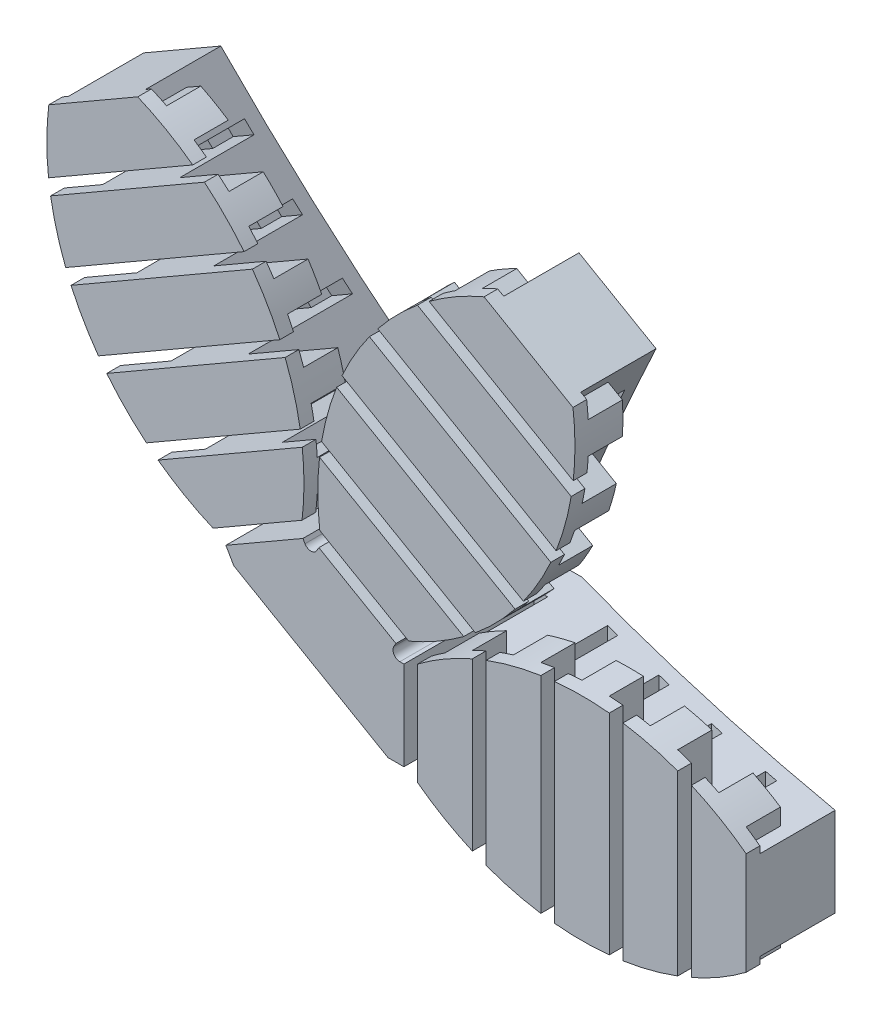
from build123d import *

# Parameters (mm, degrees)
AUFSATZ_LINEAR_AUSTRAGEN7_DEPTH  = 1
AUFSATZ_LINEAR_AUSTRAGEN1_DEPTH  = 6.5
AUFSATZ_LINEAR_AUSTRAGEN2_DEPTH  = 2
SCHNITT_LINEAR_AUSTRAGEN1_DEPTH  = 15.3
AUFSATZ_LINEAR_AUSTRAGEN3_DEPTH  = 3
KREISMUSTER4_COUNT               = 3
KREISMUSTER4_ANGLE               = 120
WANDUNG1_START                   = -18
WANDUNG1_DEPTH                   = 9
WANDUNG1_START_2                 = -14.5
WANDUNG1_2_DEPTH                 = 2
WANDUNG1_3_DEPTH                 = 9
WANDUNG1_4_DEPTH                 = 2
WANDUNG1_START_3                 = -4.5
WANDUNG1_5_DEPTH                 = 9
WANDUNG1_START_4                 = -1
WANDUNG1_6_DEPTH                 = 2
AUFSATZ_LINEAR_AUSTRAGEN4_DEPTH  = 5
SOCKEL_DEPTH                     = 23
AUFSATZ_LINEAR_AUSTRAGEN6_DEPTH  = 6.5
KREISMUSTER6_COUNT               = 3
KREISMUSTER6_ANGLE               = 120
VERRUNDUNG1_R                    = 1
SKIZZE10_W                       = 2
SKIZZE10_H                       = 2
SCHNITT_LINEAR_AUSTRAGEN3_DEPTH  = 2
SCHNITT_LINEAR_AUSTRAGEN7_DEPTH  = 21
SCHNITT_LINEAR_AUSTRAGEN4_DEPTH  = 2
SKIZZE15_W                       = 4
SKIZZE15_H                       = 2
SCHNITT_LINEAR_AUSTRAGEN6_DEPTH  = 2
AUFSATZ_LINEAR_START             = -1
AUFSATZ_LINEAR_AUSTRAGEN8_DEPTH  = 1
AUFSATZ_LINEAR_START_2           = 3
SKIZZE20_W                       = 2
SKIZZE20_H                       = 1
AUFSATZ_LINEAR_AUSTRAGEN9_DEPTH  = 4
AUFSATZ_LINEAR_START_3           = 11
AUFSATZ_LINEAR_AUSTRAGEN10_DEPTH = 11
KREISMUSTER7_COUNT               = 3
KREISMUSTER7_ANGLE               = 120
KREISMUSTER7_START               = -1
KREISMUSTER7_COPY_1_DEPTH        = 1
KREISMUSTER7_COPY_2_DEPTH        = 1
KREISMUSTER7_START_2             = 3
KREISMUSTER7_COPY_3_SKETCH_W     = 2
KREISMUSTER7_COPY_3_SKETCH_H     = 1
KREISMUSTER7_COPY_3_DEPTH        = 4
KREISMUSTER7_COPY_4_SKETCH_W     = 2
KREISMUSTER7_COPY_4_SKETCH_H     = 1
KREISMUSTER7_COPY_4_DEPTH        = 4
AUFSATZ_LINEAR_START_4           = 1
AUFSATZ_LINEAR_AUSTRAGEN11_DEPTH = 1


# Read off the part's stored shape, not the designer's step: Wandung1
with BuildPart() as part:
    # Skizze8 → Aufsatz-Linear austragen7 (new body)
    with BuildSketch(Plane.XY):
        with BuildLine():
            Line((-4.763139721, -6.25), (-26.413774815, 6.25))
            ThreePointArc((-26.413774815, 6.25), (-24.774043804, 8.477912479), (-22.684450569, 10.290620927))
            Line((-22.684450569, 10.290620927), (-24.248711306, 13))
            Line((-24.248711306, 13), (-22.516660498, 14))
            Line((-22.516660498, 14), (-20.952399762, 11.290620927))
            ThreePointArc((-20.952399762, 11.290620927), (-15.588457268, 12.5), (-10.224514775, 11.290620927))
            Line((-10.224514775, 11.290620927), (-8.660254038, 14))
            Line((-8.660254038, 14), (-6.92820323, 13))
            Line((-6.92820323, 13), (-8.492463967, 10.290620927))
            ThreePointArc((-8.492463967, 10.290620927), (-4.763139721, 6.25), (-3.128521474, 1))
            Line((-3.128521474, 1), (0, 1))
            Line((0, 1), (0, -1))
            Line((0, -1), (-3.128521474, -1))
            ThreePointArc((-3.128521474, -1), (-3.653576423, -3.715995049), (-4.763139721, -6.25))
        make_face()
    extrude(amount=-AUFSATZ_LINEAR_AUSTRAGEN7_DEPTH)

    # Skizze2 → Aufsatz-Linear austragen1 (add, symmetric)
    with BuildSketch(Plane(origin=(0, 0, 0), x_dir=(1, 0, 0), z_dir=(0, 1, 0))):
        with BuildLine():
            Line((0, 23), (0, 0))
            Line((0, 0), (48, 0))
            Line((48, 0), (48, 12))
            ThreePointArc((48, 12), (23.86042445, 16.890943056), (0, 23))
        make_face()
    aufsatz_linear_austragen1 = extrude(amount=AUFSATZ_LINEAR_AUSTRAGEN1_DEPTH, both=True)

    # Skizze1 → Aufsatz-Linear austragen2 (add)
    with BuildSketch(Plane.XY):
        with BuildLine():
            Line((0, -7.5), (0, 7.5))
            ThreePointArc((0, 7.5), (24, 15.5), (48, 7.5))
            Line((48, 7.5), (48, -7.5))
            ThreePointArc((48, -7.5), (24, -15.5), (0, -7.5))
        make_face()
    aufsatz_linear_austragen2 = extrude(amount=-AUFSATZ_LINEAR_AUSTRAGEN2_DEPTH)

    # Skizze3 → Schnitt-Linear austragen1 (cut, symmetric)
    with BuildSketch(Plane(origin=(0, 0, 0), x_dir=(1, 0, 0), z_dir=(0, 1, 0))):
        Polygon((8, 0), (8, 19.77324167), (10, 19.249193658), (10, 0), align=None)
        Polygon((18, 0), (18, 17.243401122), (20, 16.764409199), (20, 0), align=None)
        Polygon((28, 0), (28, 14.937451344), (30, 14.502836106), (30, 0), align=None)
        Polygon((38, 0), (38, 12.852146674), (40, 12.461303435), (40, 0), align=None)
    schnitt_linear_austragen1 = extrude(amount=SCHNITT_LINEAR_AUSTRAGEN1_DEPTH, both=True, mode=Mode.SUBTRACT)

    # Skizze4 → Aufsatz-Linear austragen3 (add, symmetric)
    with BuildSketch(Plane(origin=(0, 0, 0), x_dir=(1, 0, 0), z_dir=(0, 1, 0))):
        Polygon((8, 16.77324167), (8, 19.77324167), (10, 19.249193658), (10, 16.249193658), align=None)
        Polygon((18, 14.243401122), (18, 17.243401122), (20, 16.764409199), (20, 13.764409199), align=None)
        Polygon((28, 11.937451344), (28, 14.937451344), (30, 14.502836106), (30, 11.502836106), align=None)
        Polygon((38, 9.852146674), (38, 12.852146674), (40, 12.461303435), (40, 9.461303435), align=None)
    aufsatz_linear_austragen3 = extrude(amount=AUFSATZ_LINEAR_AUSTRAGEN3_DEPTH, both=True)

    # Kreismuster4: Aufsatz-Linear austragen1, Aufsatz-Linear austragen2, Schnitt-Linear austragen1, Aufsatz-Linear austragen3 ×3 about axis
    kreismuster4_axis = Axis((-15.588457268, 0, 0), (0, 0, 1))
    add([aufsatz_linear_austragen1.rotate(kreismuster4_axis, i * KREISMUSTER4_ANGLE / (KREISMUSTER4_COUNT - 1)) for i in range(1, KREISMUSTER4_COUNT)])
    add([aufsatz_linear_austragen2.rotate(kreismuster4_axis, i * KREISMUSTER4_ANGLE / (KREISMUSTER4_COUNT - 1)) for i in range(1, KREISMUSTER4_COUNT)])
    add([schnitt_linear_austragen1.rotate(kreismuster4_axis, i * KREISMUSTER4_ANGLE / (KREISMUSTER4_COUNT - 1)) for i in range(1, KREISMUSTER4_COUNT)], mode=Mode.SUBTRACT)
    add([aufsatz_linear_austragen3.rotate(kreismuster4_axis, i * KREISMUSTER4_ANGLE / (KREISMUSTER4_COUNT - 1)) for i in range(1, KREISMUSTER4_COUNT)])

    # Wandung1 outline → Wandung1 (cut)
    with BuildSketch(Plane(origin=(0, 0, 0), x_dir=(0.500000000000004, -0.8660254037844363, 0), z_dir=(0.8660254037844363, 0.5000000000000042, 0)).offset(WANDUNG1_START)):
        with BuildLine():
            Line((-69.382685902, 12.356970834), (-69.382685902, 2))
            Line((-69.382685902, 2), (-64.382685902, 2))
            Line((-64.382685902, 2), (-64.382685902, 13.287271037))
            ThreePointArc((-64.382685902, 13.287271037), (-66.881467565, 12.815572851), (-69.382685902, 12.356970834))
        make_face()
        with BuildLine():
            Line((-60.382685902, 14.070634881), (-60.382685902, 2))
            Line((-60.382685902, 2), (-54.382685902, 2))
            Line((-54.382685902, 2), (-54.382685902, 15.311291382))
            ThreePointArc((-54.382685902, 15.311291382), (-57.380728501, 14.68149685), (-60.382685902, 14.070634881))
        make_face()
        with BuildLine():
            ThreePointArc((-44.382685902, 17.555569802), (-47.380509467, 16.859476754), (-50.382685902, 16.182403412))
            Line((-50.382685902, 16.182403412), (-50.382685902, 2))
            Line((-50.382685902, 2), (-44.382685902, 2))
            Line((-44.382685902, 2), (-44.382685902, 17.555569802))
        make_face()
        with BuildLine():
            ThreePointArc((-34.382685902, 20.023261295), (-37.380284188, 19.259896067), (-40.382685902, 18.515647523))
            Line((-40.382685902, 18.515647523), (-40.382685902, 2))
            Line((-40.382685902, 2), (-34.382685902, 2))
            Line((-34.382685902, 2), (-34.382685902, 20.023261295))
        make_face()
        with BuildLine():
            ThreePointArc((-24.382685902, 22.717904905), (-27.380051853, 21.886176888), (-30.382685902, 21.073672793))
            Line((-30.382685902, 21.073672793), (-30.382685902, 2))
            Line((-30.382685902, 2), (-24.382685902, 2))
            Line((-24.382685902, 2), (-24.382685902, 22.717904905))
        make_face()
    extrude(amount=WANDUNG1_DEPTH, mode=Mode.SUBTRACT)

    # Wandung1 2 outline → Wandung1 2 (cut)
    with BuildSketch(Plane(origin=(0, 0, 0), x_dir=(0.500000000000004, -0.8660254037844363, 0), z_dir=(0.8660254037844363, 0.5000000000000042, 0)).offset(WANDUNG1_START_2)):
        with BuildLine():
            Line((-64.382685902, 13.287271037), (-64.382685902, 11.303713614))
            Line((-64.382685902, 11.303713614), (-60.382685902, 12.085400091))
            Line((-60.382685902, 12.085400091), (-60.382685902, 14.070634881))
            ThreePointArc((-60.382685902, 14.070634881), (-62.381863699, 13.674754637), (-64.382685902, 13.287271037))
        make_face()
        with BuildLine():
            ThreePointArc((-50.382685902, 16.182403412), (-52.381767614, 15.742630771), (-54.382685902, 15.311291382))
            Line((-54.382685902, 15.311291382), (-54.382685902, 13.332206382))
            Line((-54.382685902, 13.332206382), (-50.382685902, 14.201436857))
            Line((-50.382685902, 14.201436857), (-50.382685902, 16.182403412))
        make_face()
        with BuildLine():
            ThreePointArc((-40.382685902, 18.515647523), (-42.381668923, 18.031371591), (-44.382685902, 17.555569802))
            Line((-44.382685902, 17.555569802), (-44.382685902, 15.581471835))
            Line((-44.382685902, 15.581471835), (-40.382685902, 16.53945568))
            Line((-40.382685902, 16.53945568), (-40.382685902, 18.515647523))
        make_face()
        with BuildLine():
            ThreePointArc((-30.382685902, 21.073672793), (-32.38156728, 20.544207296), (-34.382685902, 20.023261295))
            Line((-34.382685902, 20.023261295), (-34.382685902, 18.054686598))
            Line((-34.382685902, 18.054686598), (-30.382685902, 19.102782621))
            Line((-30.382685902, 19.102782621), (-30.382685902, 21.073672793))
        make_face()
    extrude(amount=WANDUNG1_2_DEPTH, mode=Mode.SUBTRACT)

    # Wandung1 3 outline → Wandung1 3 (cut)
    with BuildSketch(Plane(origin=(0, 0, 0), x_dir=(0.49999999999999767, 0.86602540378444, 0), z_dir=(0.8660254037844399, -0.49999999999999795, 0)).offset(WANDUNG1_START)):
        with BuildLine():
            Line((53.794228634, -12.356970834), (53.794228634, -2))
            Line((53.794228634, -2), (48.794228634, -2))
            Line((48.794228634, -2), (48.794228634, -13.287271037))
            ThreePointArc((48.794228634, -13.287271037), (51.293010297, -12.815572851), (53.794228634, -12.356970834))
        make_face()
        with BuildLine():
            Line((44.794228634, -14.070634881), (44.794228634, -2))
            Line((44.794228634, -2), (38.794228634, -2))
            Line((38.794228634, -2), (38.794228634, -15.311291382))
            ThreePointArc((38.794228634, -15.311291382), (41.792271233, -14.68149685), (44.794228634, -14.070634881))
        make_face()
        with BuildLine():
            ThreePointArc((28.794228634, -17.555569802), (31.792052199, -16.859476754), (34.794228634, -16.182403412))
            Line((34.794228634, -16.182403412), (34.794228634, -2))
            Line((34.794228634, -2), (28.794228634, -2))
            Line((28.794228634, -2), (28.794228634, -17.555569802))
        make_face()
        with BuildLine():
            ThreePointArc((18.794228634, -20.023261295), (21.79182692, -19.259896067), (24.794228634, -18.515647523))
            Line((24.794228634, -18.515647523), (24.794228634, -2))
            Line((24.794228634, -2), (18.794228634, -2))
            Line((18.794228634, -2), (18.794228634, -20.023261295))
        make_face()
        with BuildLine():
            ThreePointArc((8.794228634, -22.717904905), (11.791594585, -21.886176888), (14.794228634, -21.073672793))
            Line((14.794228634, -21.073672793), (14.794228634, -2))
            Line((14.794228634, -2), (8.794228634, -2))
            Line((8.794228634, -2), (8.794228634, -22.717904905))
        make_face()
    extrude(amount=WANDUNG1_3_DEPTH, mode=Mode.SUBTRACT)

    # Wandung1 4 outline → Wandung1 4 (cut)
    with BuildSketch(Plane(origin=(0, 0, 0), x_dir=(0.49999999999999767, 0.86602540378444, 0), z_dir=(0.8660254037844399, -0.49999999999999795, 0)).offset(WANDUNG1_START_2)):
        with BuildLine():
            Line((48.794228634, -13.287271037), (48.794228634, -11.303713614))
            Line((48.794228634, -11.303713614), (44.794228634, -12.085400091))
            Line((44.794228634, -12.085400091), (44.794228634, -14.070634881))
            ThreePointArc((44.794228634, -14.070634881), (46.793406431, -13.674754637), (48.794228634, -13.287271037))
        make_face()
        with BuildLine():
            ThreePointArc((34.794228634, -16.182403412), (36.793310346, -15.742630771), (38.794228634, -15.311291382))
            Line((38.794228634, -15.311291382), (38.794228634, -13.332206382))
            Line((38.794228634, -13.332206382), (34.794228634, -14.201436857))
            Line((34.794228634, -14.201436857), (34.794228634, -16.182403412))
        make_face()
        with BuildLine():
            ThreePointArc((24.794228634, -18.515647523), (26.793211655, -18.031371591), (28.794228634, -17.555569802))
            Line((28.794228634, -17.555569802), (28.794228634, -15.581471835))
            Line((28.794228634, -15.581471835), (24.794228634, -16.53945568))
            Line((24.794228634, -16.53945568), (24.794228634, -18.515647523))
        make_face()
        with BuildLine():
            ThreePointArc((14.794228634, -21.073672793), (16.793110012, -20.544207296), (18.794228634, -20.023261295))
            Line((18.794228634, -20.023261295), (18.794228634, -18.054686598))
            Line((18.794228634, -18.054686598), (14.794228634, -19.102782621))
            Line((14.794228634, -19.102782621), (14.794228634, -21.073672793))
        make_face()
    extrude(amount=WANDUNG1_4_DEPTH, mode=Mode.SUBTRACT)

    # Wandung1 5 outline → Wandung1 5 (cut)
    with BuildSketch(Plane(origin=(0, 0, 0), x_dir=(1, 0, 0), z_dir=(0, 1, 0)).offset(WANDUNG1_START_3)):
        with BuildLine():
            Line((1, 22.717904905), (1, 2))
            Line((1, 2), (7, 2))
            Line((7, 2), (7, 21.073672793))
            ThreePointArc((7, 21.073672793), (3.997365951, 21.886176888), (1, 22.717904905))
        make_face()
        with BuildLine():
            Line((11, 20.023261295), (11, 2))
            Line((11, 2), (17, 2))
            Line((17, 2), (17, 18.515647523))
            ThreePointArc((17, 18.515647523), (13.997598286, 19.259896067), (11, 20.023261295))
        make_face()
        with BuildLine():
            ThreePointArc((27, 16.182403412), (23.997823565, 16.859476754), (21, 17.555569802))
            Line((21, 17.555569802), (21, 2))
            Line((21, 2), (27, 2))
            Line((27, 2), (27, 16.182403412))
        make_face()
        with BuildLine():
            ThreePointArc((37, 14.070634881), (33.998042599, 14.68149685), (31, 15.311291382))
            Line((31, 15.311291382), (31, 2))
            Line((31, 2), (37, 2))
            Line((37, 2), (37, 14.070634881))
        make_face()
        with BuildLine():
            ThreePointArc((46, 12.356970834), (43.498781663, 12.815572851), (41, 13.287271037))
            Line((41, 13.287271037), (41, 2))
            Line((41, 2), (46, 2))
            Line((46, 2), (46, 12.356970834))
        make_face()
    extrude(amount=WANDUNG1_5_DEPTH, mode=Mode.SUBTRACT)

    # Wandung1 6 outline → Wandung1 6 (cut)
    with BuildSketch(Plane(origin=(0, 0, 0), x_dir=(1, 0, 0), z_dir=(0, 1, 0)).offset(WANDUNG1_START_4)):
        with BuildLine():
            Line((7, 21.073672793), (7, 19.102782621))
            Line((7, 19.102782621), (11, 18.054686598))
            Line((11, 18.054686598), (11, 20.023261295))
            ThreePointArc((11, 20.023261295), (8.998881378, 20.544207296), (7, 21.073672793))
        make_face()
        with BuildLine():
            ThreePointArc((21, 17.555569802), (18.998983021, 18.031371591), (17, 18.515647523))
            Line((17, 18.515647523), (17, 16.53945568))
            Line((17, 16.53945568), (21, 15.581471835))
            Line((21, 15.581471835), (21, 17.555569802))
        make_face()
        with BuildLine():
            ThreePointArc((31, 15.311291382), (28.999081712, 15.742630771), (27, 16.182403412))
            Line((27, 16.182403412), (27, 14.201436857))
            Line((27, 14.201436857), (31, 13.332206382))
            Line((31, 13.332206382), (31, 15.311291382))
        make_face()
        with BuildLine():
            ThreePointArc((41, 13.287271037), (38.999177797, 13.674754637), (37, 14.070634881))
            Line((37, 14.070634881), (37, 12.085400091))
            Line((37, 12.085400091), (41, 11.303713614))
            Line((41, 11.303713614), (41, 13.287271037))
        make_face()
    extrude(amount=WANDUNG1_6_DEPTH, mode=Mode.SUBTRACT)

    # Skizze5 → Aufsatz-Linear austragen4 (add)
    with BuildSketch(Plane(origin=(0, 0, -2), x_dir=(-1, 0, 0), z_dir=(0, 0, -1))):
        with BuildLine():
            Line((-2, 8.906586177), (-2, 6.5))
            Line((-2, 6.5), (-6, 6.5))
            Line((-6, 6.5), (-6, 11.221142199))
            ThreePointArc((-6, 11.221142199), (-3.96654567, 10.121679734), (-2, 8.906586177))
        make_face()
        with BuildLine():
            Line((-12, 13.657568057), (-12, 6.5))
            Line((-12, 6.5), (-16, 6.5))
            Line((-16, 6.5), (-16, 14.691835885))
            ThreePointArc((-16, 14.691835885), (-13.986637554, 14.226380834), (-12, 13.657568057))
        make_face()
        with BuildLine():
            Line((-22, 15.449968711), (-22, 6.5))
            Line((-22, 6.5), (-26, 6.5))
            Line((-26, 6.5), (-26, 15.449968711))
            ThreePointArc((-26, 15.449968711), (-24, 15.5), (-22, 15.449968711))
        make_face()
        with BuildLine():
            Line((-32, 14.691835885), (-32, 6.5))
            Line((-32, 6.5), (-36, 6.5))
            Line((-36, 6.5), (-36, 13.657568057))
            ThreePointArc((-36, 13.657568057), (-34.013362446, 14.226380834), (-32, 14.691835885))
        make_face()
        with BuildLine():
            Line((-42, 11.221142199), (-42, 6.5))
            Line((-42, 6.5), (-46, 6.5))
            Line((-46, 6.5), (-46, 8.906586177))
            ThreePointArc((-46, 8.906586177), (-44.03345433, 10.121679734), (-42, 11.221142199))
        make_face()
        with BuildLine():
            Line((-46, -8.906586177), (-46, -6.5))
            Line((-46, -6.5), (-42, -6.5))
            Line((-42, -6.5), (-42, -11.221142199))
            ThreePointArc((-42, -11.221142199), (-44.03345433, -10.121679734), (-46, -8.906586177))
        make_face()
        with BuildLine():
            Line((-36, -13.657568057), (-36, -6.5))
            Line((-36, -6.5), (-32, -6.5))
            Line((-32, -6.5), (-32, -14.691835885))
            ThreePointArc((-32, -14.691835885), (-34.013362446, -14.226380834), (-36, -13.657568057))
        make_face()
        with BuildLine():
            Line((-26, -15.449968711), (-26, -6.5))
            Line((-26, -6.5), (-22, -6.5))
            Line((-22, -6.5), (-22, -15.449968711))
            ThreePointArc((-22, -15.449968711), (-24, -15.5), (-26, -15.449968711))
        make_face()
        with BuildLine():
            Line((-16, -14.691835885), (-16, -6.5))
            Line((-16, -6.5), (-12, -6.5))
            Line((-12, -6.5), (-12, -13.657568057))
            ThreePointArc((-12, -13.657568057), (-13.986637554, -14.226380834), (-16, -14.691835885))
        make_face()
        with BuildLine():
            Line((-6, -11.221142199), (-6, -6.5))
            Line((-6, -6.5), (-2, -6.5))
            Line((-2, -6.5), (-2, -8.906586177))
            ThreePointArc((-2, -8.906586177), (-3.96654567, -10.121679734), (-6, -11.221142199))
        make_face()
    aufsatz_linear_austragen4 = extrude(amount=AUFSATZ_LINEAR_AUSTRAGEN4_DEPTH)

    # Skizze6 → Sockel (add)
    with BuildSketch(Plane.XY):
        Polygon((-4.330127019, -6.5), (-2, -6.5), (-2, 6.5), (-4.330127019, 6.5), (-3.165063509, 8.517949192), (-14.423393759, 15.017949192), (-15.588457268, 13), (-16.753520778, 15.017949192), (-28.011851027, 8.517949192), (-26.846787517, 6.5), align=None)
    extrude(amount=-SOCKEL_DEPTH)

    # Skizze7 → Aufsatz-Linear austragen6 (add, symmetric)
    with BuildSketch(Plane(origin=(0, 0, 0), x_dir=(1, 0, 0), z_dir=(0, 1, 0))):
        Polygon((-4, 19), (0, 19), (0, 23), (-4.330127019, 23), align=None)
    aufsatz_linear_austragen6 = extrude(amount=AUFSATZ_LINEAR_AUSTRAGEN6_DEPTH, both=True)

    # Kreismuster6: Aufsatz-Linear austragen4, Aufsatz-Linear austragen6 ×3 about axis
    kreismuster6_axis = Axis((-15.588457268, 0, 0), (0, 0, 1))
    add([aufsatz_linear_austragen4.rotate(kreismuster6_axis, i * KREISMUSTER6_ANGLE / (KREISMUSTER6_COUNT - 1)) for i in range(1, KREISMUSTER6_COUNT)])
    add([aufsatz_linear_austragen6.rotate(kreismuster6_axis, i * KREISMUSTER6_ANGLE / (KREISMUSTER6_COUNT - 1)) for i in range(1, KREISMUSTER6_COUNT)])

    # Verrundung1
    verrundung1_edges = [part.edges().sort_by_distance(p)[0] for p in [
        (-15.588457268, 13, -11.5),
        (-4.330127019, 6.5, -11.5),
    ]]
    fillet(verrundung1_edges, radius=VERRUNDUNG1_R)

    # Skizze10 → Schnitt-Linear austragen3 (cut)
    with BuildSketch(Plane.XY):
        with Locations((-1, 0)):
            Rectangle(SKIZZE10_W, SKIZZE10_H)
        Polygon((-6.92820323, 13), (-8.660254038, 14), (-9.660254038, 12.267949192), (-7.92820323, 11.267949192), align=None)
        Polygon((-22.516660498, 14), (-21.516660498, 12.267949192), (-23.248711306, 11.267949192), (-24.248711306, 13), align=None)
    extrude(amount=-SCHNITT_LINEAR_AUSTRAGEN3_DEPTH, mode=Mode.SUBTRACT)

    # Skizze18 → Schnitt-Linear austragen7 (cut)
    with BuildSketch(Plane(origin=(0, 0, -23), x_dir=(-1, 0, 0), z_dir=(0, 0, -1))):
        with BuildLine():
            Line((3, 4.5), (3, -4.5))
            Line((3, -4.5), (4.495190528, -3.636751346))
            Line((4.495190528, -3.636751346), (4.495190528, -1.785898385))
            Line((4.495190528, -1.785898385), (22.681724008, 8.714101615))
            Line((22.681724008, 8.714101615), (24.284609691, 7.788675135))
            Line((24.284609691, 7.788675135), (25.779800219, 8.651923789))
            Line((25.779800219, 8.651923789), (17.985571585, 13.151923789))
            Line((17.985571585, 13.151923789), (17.320508076, 12))
            ThreePointArc((17.320508076, 12), (15.588457268, 11), (13.856406461, 12))
            Line((13.856406461, 12), (13.191342951, 13.151923789))
            Line((13.191342951, 13.151923789), (5.397114317, 8.651923789))
            Line((5.397114317, 8.651923789), (6.062177826, 7.5))
            ThreePointArc((6.062177826, 7.5), (6.062177826, 5.5), (4.330127019, 4.5))
            Line((4.330127019, 4.5), (3, 4.5))
        make_face()
    extrude(amount=-SCHNITT_LINEAR_AUSTRAGEN7_DEPTH, mode=Mode.SUBTRACT)

    # Skizze11 → Schnitt-Linear austragen4 (cut)
    with BuildSketch(Plane(origin=(-3.897114317, -6.75, 0), x_dir=(0.8660254037844386, -0.5000000000000003, 0), z_dir=(-0.5000000000000003, -0.8660254037844386, 0))):
        Polygon((-3.5, -1), (-23.5, -1), (-23.5, -18), (-23.5, -23), (-3.5, -23), (-3.5, -18), align=None)
    extrude(amount=-SCHNITT_LINEAR_AUSTRAGEN4_DEPTH, mode=Mode.SUBTRACT)

    # Skizze15 → Schnitt-Linear austragen6 (cut)
    with BuildSketch(Plane(origin=(0, 0, -23), x_dir=(-1, 0, 0), z_dir=(0, 0, -1))):
        with Locations((1, 0)):
            Rectangle(SKIZZE15_W, SKIZZE15_H)
        Polygon((8.42820323, 10.401923789), (10.160254038, 11.401923789), (8.160254038, 14.866025404), (6.42820323, 13.866025404), align=None)
        Polygon((23.016660498, 14.866025404), (24.748711306, 13.866025404), (22.748711306, 10.401923789), (21.016660498, 11.401923789), align=None)
    extrude(amount=-SCHNITT_LINEAR_AUSTRAGEN6_DEPTH, mode=Mode.SUBTRACT)

    # Skizze19 → Aufsatz-Linear austragen8 (add)
    with BuildSketch(Plane.XZ.offset(6.5).offset(AUFSATZ_LINEAR_START)):
        with BuildLine():
            Line((0, -23), (0, -24))
            ThreePointArc((0, -24), (23.86042445, -17.890943056), (48, -13))
            Line((48, -13), (48, -12))
            ThreePointArc((48, -12), (23.86042445, -16.890943056), (0, -23))
        make_face()
    aufsatz_linear_austragen8 = extrude(amount=AUFSATZ_LINEAR_AUSTRAGEN8_DEPTH)

    # Skizze20 → Aufsatz-Linear austragen9 (add)
    with BuildSketch(Plane(origin=(0, -5.5, 0), x_dir=(1, 0, 0), z_dir=(0, 1, 0)).offset(AUFSATZ_LINEAR_START_2)):
        with BuildLine():
            Line((18.026840401, 18.265763973), (18.25368655, 19.210879744))
            ThreePointArc((18.25368655, 19.210879744), (19.225941863, 18.976954759), (20.198677003, 18.745033135))
            Line((20.198677003, 18.745033135), (19.97160643, 17.798982339))
            ThreePointArc((19.97160643, 17.798982339), (18.998983021, 18.031371591), (18.026840401, 18.265763973))
        make_face()
        with BuildLine():
            Line((8.031936466, 20.799194742), (8.277482407, 21.734241405))
            ThreePointArc((8.277482407, 21.734241405), (9.244560736, 21.479759891), (10.212161249, 21.227271116))
            Line((10.212161249, 21.227271116), (9.966349517, 20.291212314))
            ThreePointArc((9.966349517, 20.291212314), (8.998881378, 20.544207296), (8.031936466, 20.799194742))
        make_face()
        with BuildLine():
            Line((28.022203025, 15.956427618), (28.230036742, 16.91076511))
            ThreePointArc((28.230036742, 16.91076511), (29.207009148, 16.697396481), (30.184419024, 16.486040886))
            Line((30.184419024, 16.486040886), (29.976398751, 15.530846766))
            ThreePointArc((29.976398751, 15.530846766), (28.999081712, 15.742630771), (28.022203025, 15.956427618))
        make_face()
        with BuildLine():
            Line((38.206556429, 14.830667276), (38.018018027, 13.867955486))
            ThreePointArc((38.018018027, 13.867955486), (38.999177797, 13.674754637), (39.980733481, 13.483575406))
            Line((39.980733481, 13.483575406), (40.169424066, 14.447064266))
            ThreePointArc((40.169424066, 14.447064266), (39.18779269, 14.637854884), (38.206556429, 14.830667276))
        make_face()
        with Locations((-1, 23.5)):
            Rectangle(SKIZZE20_W, SKIZZE20_H)
    aufsatz_linear_austragen9 = extrude(amount=-AUFSATZ_LINEAR_AUSTRAGEN9_DEPTH)

    # Skizze21 → Aufsatz-Linear austragen10 (add)
    with BuildSketch(Plane(origin=(0, -5.5, 0), x_dir=(1, 0, 0), z_dir=(0, 1, 0)).offset(AUFSATZ_LINEAR_START_3)):
        with BuildLine():
            Line((47, 12.177405797), (47, 13.177405797))
            ThreePointArc((47, 13.177405797), (47.499953604, 13.088441375), (48, 13))
            Line((48, 13), (48, 12))
            ThreePointArc((48, 12), (47.499953604, 12.088441375), (47, 12.177405797))
        make_face()
    aufsatz_linear_austragen10 = extrude(amount=-AUFSATZ_LINEAR_AUSTRAGEN10_DEPTH)

    # Spiegeln1: Aufsatz-Linear austragen8, Aufsatz-Linear austragen9 across plane
    add(aufsatz_linear_austragen8.mirror(Plane.ZX))
    add(aufsatz_linear_austragen9.mirror(Plane.ZX))

    # Kreismuster7: Aufsatz-Linear austragen8, Aufsatz-Linear austragen9, Aufsatz-Linear austragen10 ×3 about axis
    kreismuster7_axis = Axis((-15.588457268, 0, 0), (0, 0, 1))
    add([aufsatz_linear_austragen8.rotate(kreismuster7_axis, i * KREISMUSTER7_ANGLE / (KREISMUSTER7_COUNT - 1)) for i in range(1, KREISMUSTER7_COUNT)])
    add([aufsatz_linear_austragen9.rotate(kreismuster7_axis, i * KREISMUSTER7_ANGLE / (KREISMUSTER7_COUNT - 1)) for i in range(1, KREISMUSTER7_COUNT)])
    add([aufsatz_linear_austragen10.rotate(kreismuster7_axis, i * KREISMUSTER7_ANGLE / (KREISMUSTER7_COUNT - 1)) for i in range(1, KREISMUSTER7_COUNT)])

    # Kreismuster7 copy 1 sketch → Kreismuster7 copy 1 (add)
    with BuildSketch(Plane(origin=(-13.423393759, 16.75, 0), x_dir=(0.4999999999999978, 0.8660254037844399, 0), z_dir=(-0.8660254037844399, 0.4999999999999978, 0)).offset(KREISMUSTER7_START)):
        with BuildLine():
            Line((0, 23), (0, 24))
            ThreePointArc((0, 24), (23.86042445, 17.890943056), (48, 13))
            Line((48, 13), (48, 12))
            ThreePointArc((48, 12), (23.86042445, 16.890943056), (0, 23))
        make_face()
    extrude(amount=KREISMUSTER7_COPY_1_DEPTH)

    # Kreismuster7 copy 2 sketch → Kreismuster7 copy 2 (add)
    with BuildSketch(Plane(origin=(-29.011851027, 10.25, 0), x_dir=(-0.5000000000000044, 0.866025403784436, 0), z_dir=(-0.866025403784436, -0.5000000000000044, 0)).offset(KREISMUSTER7_START)):
        with BuildLine():
            Line((0, 23), (0, 24))
            ThreePointArc((0, 24), (23.86042445, 17.890943056), (48, 13))
            Line((48, 13), (48, 12))
            ThreePointArc((48, 12), (23.86042445, 16.890943056), (0, 23))
        make_face()
    extrude(amount=KREISMUSTER7_COPY_2_DEPTH)

    # Kreismuster7 copy 3 sketch → Kreismuster7 copy 3 (add)
    with BuildSketch(Plane(origin=(-12.557368355, 16.25, 0), x_dir=(0.4999999999999978, 0.8660254037844399, 0), z_dir=(0.8660254037844399, -0.4999999999999978, 0)).offset(KREISMUSTER7_START_2)):
        with BuildLine():
            Line((18.026840401, -18.265763973), (18.25368655, -19.210879744))
            ThreePointArc((18.25368655, -19.210879744), (19.225941863, -18.976954759), (20.198677003, -18.745033135))
            Line((20.198677003, -18.745033135), (19.97160643, -17.798982339))
            ThreePointArc((19.97160643, -17.798982339), (18.998983021, -18.031371591), (18.026840401, -18.265763973))
        make_face()
        with BuildLine():
            Line((8.031936466, -20.799194742), (8.277482407, -21.734241405))
            ThreePointArc((8.277482407, -21.734241405), (9.244560736, -21.479759891), (10.212161249, -21.227271116))
            Line((10.212161249, -21.227271116), (9.966349517, -20.291212314))
            ThreePointArc((9.966349517, -20.291212314), (8.998881378, -20.544207296), (8.031936466, -20.799194742))
        make_face()
        with BuildLine():
            Line((28.022203025, -15.956427618), (28.230036742, -16.91076511))
            ThreePointArc((28.230036742, -16.91076511), (29.207009148, -16.697396481), (30.184419024, -16.486040886))
            Line((30.184419024, -16.486040886), (29.976398751, -15.530846766))
            ThreePointArc((29.976398751, -15.530846766), (28.999081712, -15.742630771), (28.022203025, -15.956427618))
        make_face()
        with BuildLine():
            Line((38.206556429, -14.830667276), (38.018018027, -13.867955486))
            ThreePointArc((38.018018027, -13.867955486), (38.999177797, -13.674754637), (39.980733481, -13.483575406))
            Line((39.980733481, -13.483575406), (40.169424066, -14.447064266))
            ThreePointArc((40.169424066, -14.447064266), (39.18779269, -14.637854884), (38.206556429, -14.830667276))
        make_face()
        with Locations((-1, -23.5)):
            Rectangle(KREISMUSTER7_COPY_3_SKETCH_W, KREISMUSTER7_COPY_3_SKETCH_H)
    extrude(amount=-KREISMUSTER7_COPY_3_DEPTH)

    # Kreismuster7 copy 4 sketch → Kreismuster7 copy 4 (add)
    with BuildSketch(Plane(origin=(-28.145825623, 10.75, 0), x_dir=(-0.5000000000000044, 0.866025403784436, 0), z_dir=(0.866025403784436, 0.5000000000000044, 0)).offset(KREISMUSTER7_START_2)):
        with BuildLine():
            Line((18.026840401, -18.265763973), (18.25368655, -19.210879744))
            ThreePointArc((18.25368655, -19.210879744), (19.225941863, -18.976954759), (20.198677003, -18.745033135))
            Line((20.198677003, -18.745033135), (19.97160643, -17.798982339))
            ThreePointArc((19.97160643, -17.798982339), (18.998983021, -18.031371591), (18.026840401, -18.265763973))
        make_face()
        with BuildLine():
            Line((8.031936466, -20.799194742), (8.277482407, -21.734241405))
            ThreePointArc((8.277482407, -21.734241405), (9.244560736, -21.479759891), (10.212161249, -21.227271116))
            Line((10.212161249, -21.227271116), (9.966349517, -20.291212314))
            ThreePointArc((9.966349517, -20.291212314), (8.998881378, -20.544207296), (8.031936466, -20.799194742))
        make_face()
        with BuildLine():
            Line((28.022203025, -15.956427618), (28.230036742, -16.91076511))
            ThreePointArc((28.230036742, -16.91076511), (29.207009148, -16.697396481), (30.184419024, -16.486040886))
            Line((30.184419024, -16.486040886), (29.976398751, -15.530846766))
            ThreePointArc((29.976398751, -15.530846766), (28.999081712, -15.742630771), (28.022203025, -15.956427618))
        make_face()
        with BuildLine():
            Line((38.206556429, -14.830667276), (38.018018027, -13.867955486))
            ThreePointArc((38.018018027, -13.867955486), (38.999177797, -13.674754637), (39.980733481, -13.483575406))
            Line((39.980733481, -13.483575406), (40.169424066, -14.447064266))
            ThreePointArc((40.169424066, -14.447064266), (39.18779269, -14.637854884), (38.206556429, -14.830667276))
        make_face()
        with Locations((-1, -23.5)):
            Rectangle(KREISMUSTER7_COPY_4_SKETCH_W, KREISMUSTER7_COPY_4_SKETCH_H)
    extrude(amount=-KREISMUSTER7_COPY_4_DEPTH)

    # Skizze22 → Aufsatz-Linear austragen11 (add)
    with BuildSketch(Plane(origin=(0, 0, -23), x_dir=(-1, 0, 0), z_dir=(0, 0, -1)).offset(AUFSATZ_LINEAR_START_4)):
        Polygon((2, -5.5), (2, -6.5), (4.330127019, -6.5), (6.92820323, -5), (6.42820323, -4.133974596), (4.062177826, -5.5), align=None)
        Polygon((23.748711306, 5.866025404), (24.248711306, 5), (26.846787517, 6.5), (28.011851027, 8.517949192), (27.145825623, 9.017949192), (26.11473671, 7.232050808), align=None)
        with BuildLine():
            Line((17.619546181, 14.517949192), (16.753520778, 15.017949192))
            Line((16.753520778, 15.017949192), (16.454482672, 14.5))
            ThreePointArc((16.454482672, 14.5), (15.588457268, 14), (14.722431864, 14.5))
            Line((14.722431864, 14.5), (14.423393759, 15.017949192))
            Line((14.423393759, 15.017949192), (13.557368355, 14.517949192))
            Line((13.557368355, 14.517949192), (13.856406461, 14))
            ThreePointArc((13.856406461, 14), (15.588457268, 13), (17.320508076, 14))
            Line((17.320508076, 14), (17.619546181, 14.517949192))
        make_face()
        with BuildLine():
            Line((2.598076211, 6.5), (2, 6.5))
            Line((2, 6.5), (2, 5.5))
            Line((2, 5.5), (2.598076211, 5.5))
            ThreePointArc((2.598076211, 5.5), (4.330127019, 6.5), (4.330127019, 8.5))
            Line((4.330127019, 8.5), (4.031088913, 9.017949192))
            Line((4.031088913, 9.017949192), (3.165063509, 8.517949192))
            Line((3.165063509, 8.517949192), (3.464101615, 8))
            ThreePointArc((3.464101615, 8), (3.464101615, 7), (2.598076211, 6.5))
        make_face()
    extrude(amount=-AUFSATZ_LINEAR_AUSTRAGEN11_DEPTH)


solid = part.part
